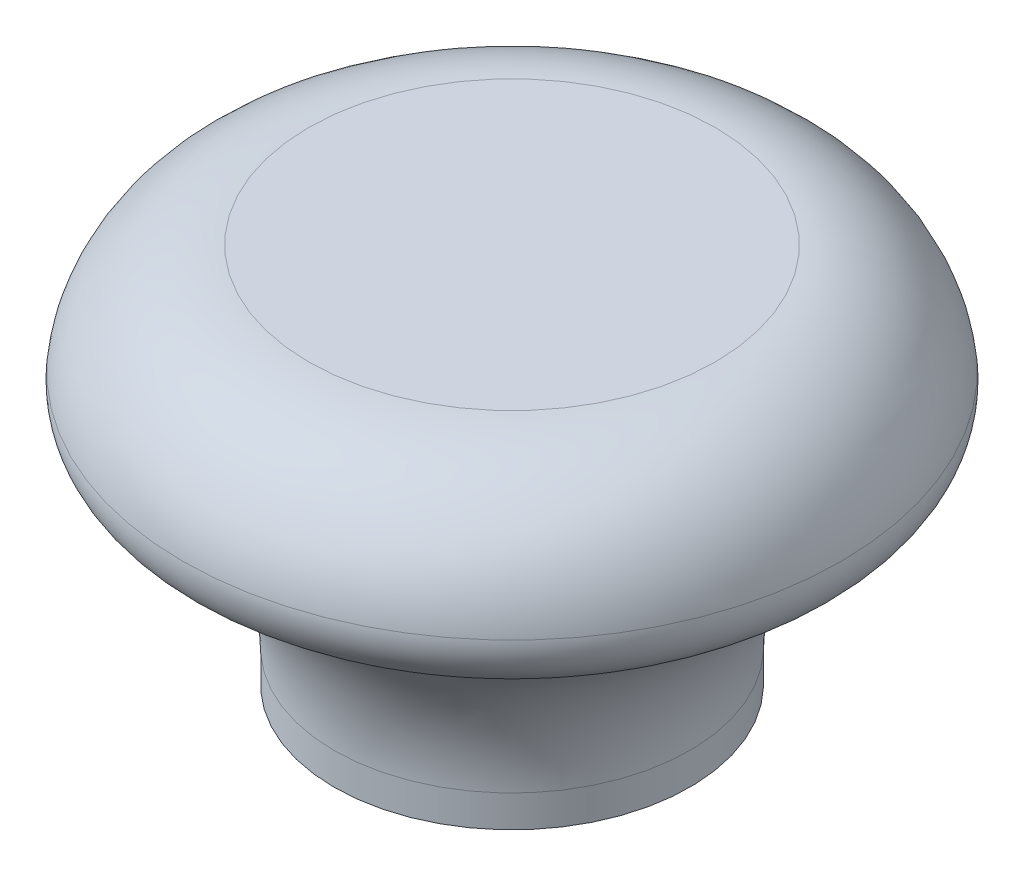
from build123d import *

# Parameters (mm, degrees)
SKETCH_1_R          = 3.5
EXTRUDE_1_DEPTH     = 4.5
SKETCH_2_R          = 6.5
EXTRUDE_2_DEPTH     = 3
FILLET_1_R          = 2.5
FILLET_2_R          = 4
SKETCH_3_W          = 3.25
SKETCH_3_H          = 2.815581646
CUT_EXTRUDE_1_DEPTH = 6.5
FILLET_3_R          = 1


with BuildPart() as part:
    # 草图1 → 凸台-拉伸1 (new body)
    with BuildSketch(Plane(origin=(0, 0, 0), x_dir=(1, 0, 0), z_dir=(0, 1, 0))):
        with Locations(Location((0, 0, 0), (0, 0, 270))):
            Circle(SKETCH_1_R)
    extrude(amount=EXTRUDE_1_DEPTH)

    # 草图2 → 凸台-拉伸2 (add)
    with BuildSketch(Plane(origin=(0, 4.5, 0), x_dir=(1, 0, 0), z_dir=(0, 1, 0))):
        with Locations(Location((0, 0, 0), (0, 0, 270))):
            Circle(SKETCH_2_R)
    extrude(amount=EXTRUDE_2_DEPTH)

    # 圆角1
    fillet_1_edges = [part.edges().sort_by_distance(p)[0] for p in [
        (0, 7.5, -6.5),
    ]]
    fillet(fillet_1_edges, radius=FILLET_1_R)

    # 圆角2
    # the kernel refuses this fillet: 4 mm, written as the material it adds along each edge
    with BuildSketch(Plane(origin=(0, 4.5, 0), x_dir=(0, 0, 1), z_dir=(-1, 0, 0))) as fillet_2_piece_1:
        with BuildLine():
            CenterArc((7.5, -3.872983346), FILLET_2_R, 104.477512186, 75.522487814)
            Line((3.5, -3.872983346), (3.42, -3.872983346))
            Line((3.42, -3.872983346), (3.42, 0))
            Line((3.42, 0), (3.5, 0.08))
            ThreePointArc((3.5, 0.08), (5, 0.08), (6.48, 0.077459667))
            Line((6.48, 0.077459667), (6.5, 0))
        make_face()
    revolve(axis=Axis((0, 4.5, 0), (0, 1, 0)))

    # 草图3 → 切除-拉伸1 (cut)
    with BuildSketch(Plane.XZ):
        with BuildLine():
            ThreePointArc((1.625, 1.407790823), (0, 2.15), (-1.625, 1.407790823))
            Line((-1.625, 1.407790823), (1.625, 1.407790823))
        make_face()
        Rectangle(SKETCH_3_W, SKETCH_3_H)
        with BuildLine():
            Line((1.625, -1.407790823), (-1.625, -1.407790823))
            ThreePointArc((-1.625, -1.407790823), (0, -2.15), (1.625, -1.407790823))
        make_face()
    extrude(amount=-CUT_EXTRUDE_1_DEPTH, mode=Mode.SUBTRACT)

    # 圆角3
    fillet_3_edges = [part.edges().sort_by_distance(p)[0] for p in [
        (0, 4.5, -6.5),
    ]]
    fillet(fillet_3_edges, radius=FILLET_3_R)


solid = part.part
